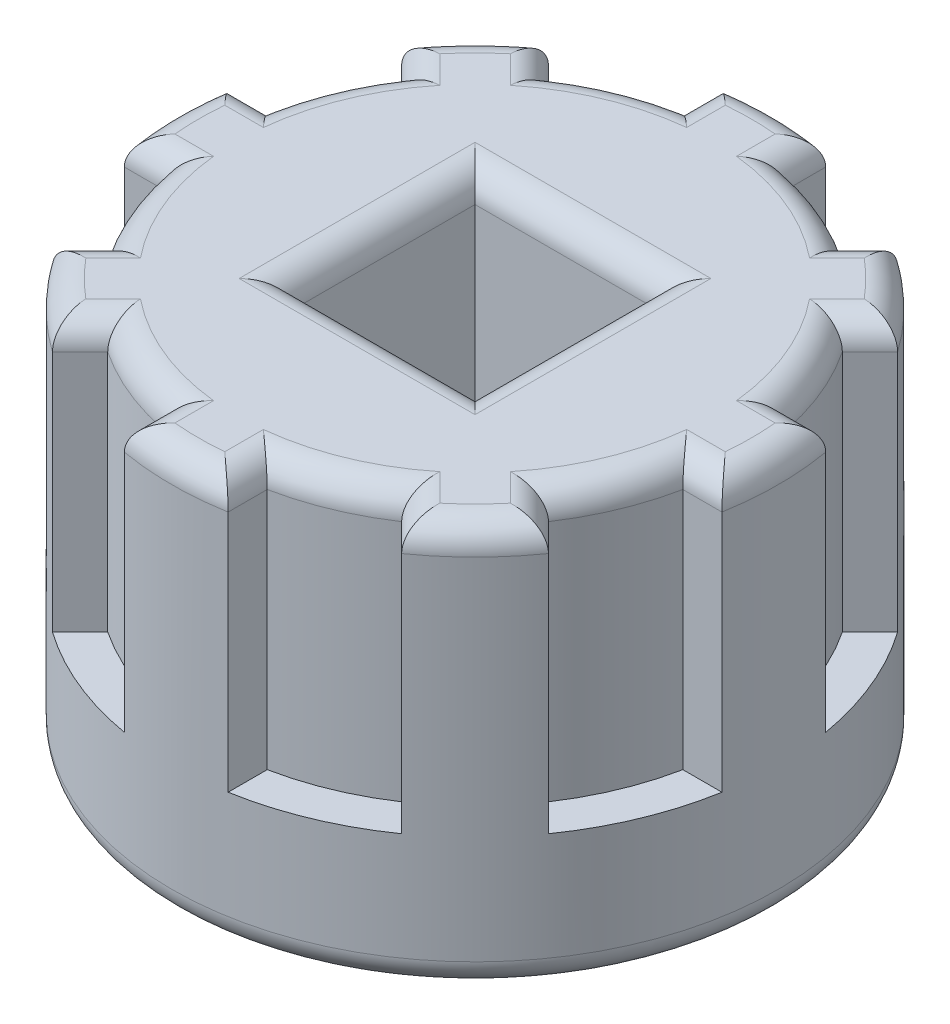
from build123d import *

# Parameters (mm, degrees)
SKETCH1_R               = 5.715
BOSS_EXTRUDE2_DEPTH     = 2.54
BOSS_EXTRUDE3_DEPTH     = 5.08
CUT_EXTRUDE1_DEPTH      = 12.10796336
CUT_EXTRUDE1_DEPTH_BACK = 12.10796336
SKETCH3_W               = 3.429
SKETCH3_H               = 3.429
FILLET1_R               = 0.508


with BuildPart() as part:
    # Sketch1 → Boss-Extrude2 (new body)
    with BuildSketch(Plane(origin=(0, 0, 0), x_dir=(1, 0, 0), z_dir=(0, 1, 0))):
        Circle(SKETCH1_R)
    extrude(amount=BOSS_EXTRUDE2_DEPTH)

    # Sketch2 → Boss-Extrude3 (add)
    with BuildSketch(Plane(origin=(0, 2.54, 0), x_dir=(1, 0, 0), z_dir=(0, 1, 0))):
        with BuildLine():
            ThreePointArc((0.9779, 5.630713684), (0, 5.715), (-0.9779, 5.630713684))
            Line((-0.9779, 5.630713684), (-0.9779, 4.894113684))
            ThreePointArc((-0.9779, 4.894113684), (-1.909917657, 4.610949111), (-2.769181252, 4.152140695))
            Line((-2.769181252, 4.152140695), (-3.290036107, 4.67299555))
            ThreePointArc((-3.290036107, 4.67299555), (-4.041115254, 4.041115254), (-4.67299555, 3.290036107))
            Line((-4.67299555, 3.290036107), (-4.152140695, 2.769181252))
            ThreePointArc((-4.152140695, 2.769181252), (-4.610949111, 1.909917657), (-4.894113684, 0.9779))
            Line((-4.894113684, 0.9779), (-5.630713684, 0.9779))
            ThreePointArc((-5.630713684, 0.9779), (-5.715, 0), (-5.630713684, -0.9779))
            Line((-5.630713684, -0.9779), (-4.894113684, -0.9779))
            ThreePointArc((-4.894113684, -0.9779), (-4.610949111, -1.909917657), (-4.152140695, -2.769181252))
            Line((-4.152140695, -2.769181252), (-4.67299555, -3.290036107))
            ThreePointArc((-4.67299555, -3.290036107), (-4.041115254, -4.041115254), (-3.290036107, -4.67299555))
            Line((-3.290036107, -4.67299555), (-2.769181252, -4.152140695))
            ThreePointArc((-2.769181252, -4.152140695), (-1.909917657, -4.610949111), (-0.9779, -4.894113684))
            Line((-0.9779, -4.894113684), (-0.9779, -5.630713684))
            ThreePointArc((-0.9779, -5.630713684), (0, -5.715), (0.9779, -5.630713684))
            Line((0.9779, -5.630713684), (0.9779, -4.894113684))
            ThreePointArc((0.9779, -4.894113684), (1.909917657, -4.610949111), (2.769181252, -4.152140695))
            Line((2.769181252, -4.152140695), (3.290036107, -4.67299555))
            ThreePointArc((3.290036107, -4.67299555), (4.041115254, -4.041115254), (4.67299555, -3.290036107))
            Line((4.67299555, -3.290036107), (4.152140695, -2.769181252))
            ThreePointArc((4.152140695, -2.769181252), (4.610949111, -1.909917657), (4.894113684, -0.9779))
            Line((4.894113684, -0.9779), (5.630713684, -0.9779))
            ThreePointArc((5.630713684, -0.9779), (5.715, 0), (5.630713684, 0.9779))
            Line((5.630713684, 0.9779), (4.894113684, 0.9779))
            ThreePointArc((4.894113684, 0.9779), (4.610949111, 1.909917657), (4.152140695, 2.769181252))
            Line((4.152140695, 2.769181252), (4.67299555, 3.290036107))
            ThreePointArc((4.67299555, 3.290036107), (4.041115254, 4.041115254), (3.290036107, 4.67299555))
            Line((3.290036107, 4.67299555), (2.769181252, 4.152140695))
            ThreePointArc((2.769181252, 4.152140695), (1.909917657, 4.610949111), (0.9779, 4.894113684))
            Line((0.9779, 4.894113684), (0.9779, 5.630713684))
        make_face()
    extrude(amount=BOSS_EXTRUDE3_DEPTH)

    # Sketch3 → Cut-Extrude1 (cut, two sides: drawn at the far end of the back side and taken through both)
    with BuildSketch(Plane(origin=(0, 7.62, 0), x_dir=(1, 0, 0), z_dir=(0, 1, 0)).offset(-CUT_EXTRUDE1_DEPTH_BACK)):
        Rectangle(SKETCH3_W, SKETCH3_H)
    extrude(amount=CUT_EXTRUDE1_DEPTH + CUT_EXTRUDE1_DEPTH_BACK, mode=Mode.SUBTRACT)

    # Fillet1
    fillet1_edges = [part.edges().sort_by_distance(p)[0] for p in [
        (-5.715, 0, 0),
        (-1.7145, 0, 0),
        (0, 0, -1.7145),
        (1.7145, 0, 0),
        (0, 0, 1.7145),
        (0, 7.62, 5.715),
        (-0.9779, 7.62, 5.262413684),
        (-1.909917657, 7.62, 4.610949111),
        (-3.02960868, 7.62, 4.412568123),
        (-4.041115254, 7.62, 4.041115254),
        (-4.412568123, 7.62, 3.02960868),
        (-4.610949111, 7.62, 1.909917657),
        (-5.262413684, 7.62, 0.9779),
        (-5.715, 7.62, 0),
        (-5.262413684, 7.62, -0.9779),
        (-4.610949111, 7.62, -1.909917657),
        (-4.412568123, 7.62, -3.02960868),
        (-4.041115254, 7.62, -4.041115254),
        (-3.02960868, 7.62, -4.412568123),
        (-1.909917657, 7.62, -4.610949111),
        (-0.9779, 7.62, -5.262413684),
        (0, 7.62, -5.715),
        (0.9779, 7.62, -5.262413684),
        (1.909917657, 7.62, -4.610949111),
        (3.02960868, 7.62, -4.412568123),
        (4.041115254, 7.62, -4.041115254),
        (4.412568123, 7.62, -3.02960868),
        (4.610949111, 7.62, -1.909917657),
        (5.262413684, 7.62, -0.9779),
        (5.715, 7.62, 0),
        (5.262413684, 7.62, 0.9779),
        (4.610949111, 7.62, 1.909917657),
        (4.412568123, 7.62, 3.02960868),
        (4.041115254, 7.62, 4.041115254),
        (3.02960868, 7.62, 4.412568123),
        (1.909917657, 7.62, 4.610949111),
        (0.9779, 7.62, 5.262413684),
        (0, 7.62, -1.7145),
        (-1.7145, 7.62, 0),
        (0, 7.62, 1.7145),
        (1.7145, 7.62, 0),
    ]]
    fillet(fillet1_edges, radius=FILLET1_R)


solid = part.part
